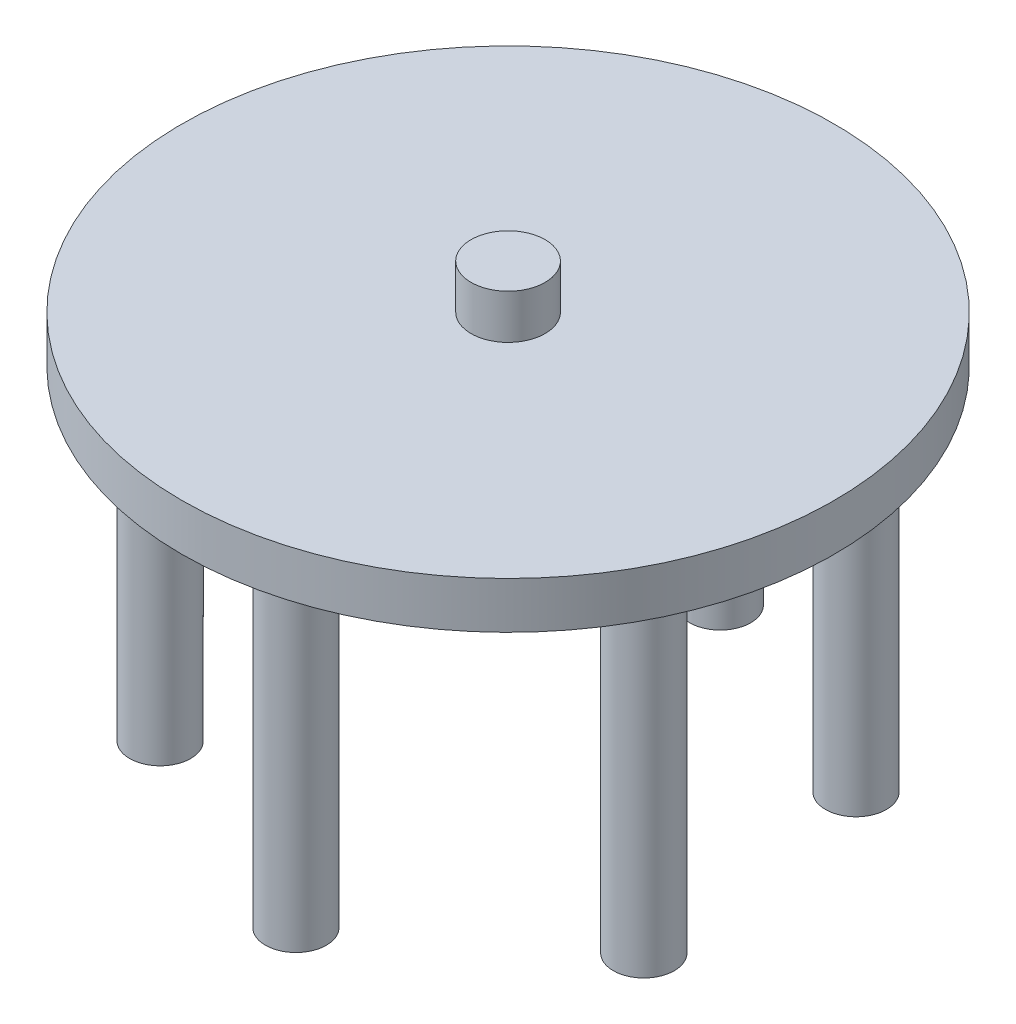
from build123d import *

# Parameters (mm, degrees)
SKETCH1_R           = 27.955
BOSS_EXTRUDE1_DEPTH = 4
SKETCH2_R           = 3.175
BOSS_EXTRUDE2_DEPTH = 3.8
SKETCH3_R           = 2.615316251
BOSS_EXTRUDE3_DEPTH = 29.718


with BuildPart() as part:
    # Sketch1 → Boss-Extrude1 (new body)
    with BuildSketch(Plane(origin=(0, 0, 0), x_dir=(1, 0, 0), z_dir=(0, 1, 0))):
        Circle(SKETCH1_R)
    extrude(amount=BOSS_EXTRUDE1_DEPTH)

    # Sketch2 → Boss-Extrude2 (add)
    with BuildSketch(Plane(origin=(0, 4, 0), x_dir=(1, 0, 0), z_dir=(0, 1, 0))):
        Circle(SKETCH2_R)
    extrude(amount=BOSS_EXTRUDE2_DEPTH)

    # Sketch3 → Boss-Extrude3 (add)
    with BuildSketch(Plane.XZ):
        with Locations((19.676080545, 8.041325394)):
            Circle(SKETCH3_R)
        with Locations((16.802032343, -13.019322902)):
            Circle(SKETCH3_R)
        with Locations((2.874048201, 21.060648295)):
            Circle(SKETCH3_R)
        with Locations((-2.874048201, -21.060648295)):
            Circle(SKETCH3_R)
        with Locations((-16.802032343, 13.019322902)):
            Circle(SKETCH3_R)
        with Locations((-19.676080545, -8.041325394)):
            Circle(SKETCH3_R)
    extrude(amount=BOSS_EXTRUDE3_DEPTH)


solid = part.part
